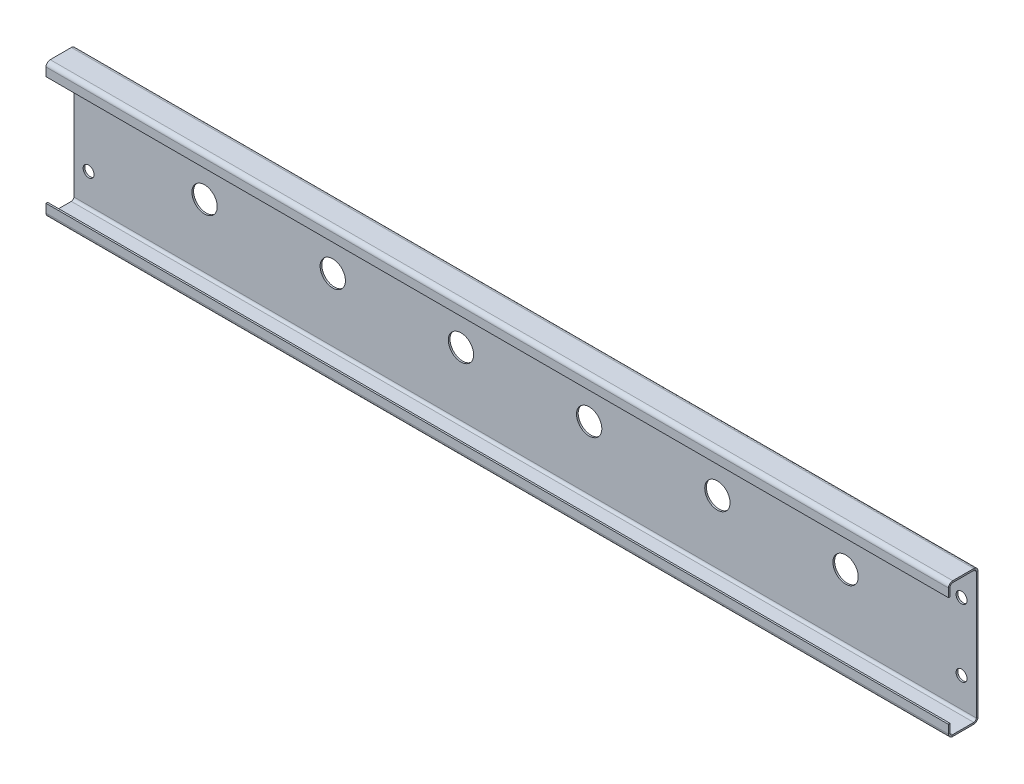
from build123d import *

# Parameters (mm, degrees)
SKETCH1_W                      = 1070
SKETCH1_H                      = 160
BASE_FLANGE1_DEPTH             = 2
EDGE_FLANGE1_STRIP_W           = 14
EDGE_FLANGE1_STRIP_H           = 2
EDGE_FLANGE1_STRIP_CUT_DEPTH   = 1070
EDGE_FLANGE1_STRIP_2_W         = 14
EDGE_FLANGE1_STRIP_2_H         = 2
EDGE_FLANGE1_STRIP_CUT_2_DEPTH = 1070
EDGE_FLANGE1_DEPTH             = 1070
EDGE_FLANGE1_BEND_DEPTH        = 1070
EDGE_FLANGE2_STRIP_W           = 14
EDGE_FLANGE2_STRIP_H           = 2
EDGE_FLANGE2_STRIP_CUT_DEPTH   = 1070
EDGE_FLANGE2_STRIP_2_W         = 14
EDGE_FLANGE2_STRIP_2_H         = 2
EDGE_FLANGE2_STRIP_CUT_2_DEPTH = 1070
EDGE_FLANGE2_DEPTH             = 1070
EDGE_FLANGE2_BEND_DEPTH        = 1070
SKETCH18_R                     = 6.5
CUT_EXTRUDE1_DEPTH             = 10
SKETCH19_R                     = 15
CUT_EXTRUDE2_DEPTH             = 542.953872576
LPATTERN1_COUNT                = 6
LPATTERN1_PITCH                = 152


# Sheet-metal steps are written as plain solids
with BuildPart() as part:
    # Sketch1 → Base-Flange1 (new body)
    with BuildSketch(Plane.XY):
        Rectangle(SKETCH1_W, SKETCH1_H)
    extrude(amount=-BASE_FLANGE1_DEPTH)

    # Edge-Flange1 strip (across the edge) → Edge-Flange1 strip cut (cut)
    with BuildSketch(Plane(origin=(535, 80, 0), x_dir=(0, -1, 0), z_dir=(-1, 0, 0))):
        with Locations((-2, -1)):
            Rectangle(EDGE_FLANGE1_STRIP_W, EDGE_FLANGE1_STRIP_H)
    extrude(amount=EDGE_FLANGE1_STRIP_CUT_DEPTH, mode=Mode.SUBTRACT)

    # Edge-Flange1 strip 2 (across the edge) → Edge-Flange1 strip cut 2 (cut)
    with BuildSketch(Plane(origin=(-535, -80, 0), x_dir=(0, 1, 0), z_dir=(1, 0, 0))):
        with Locations((-2, -1)):
            Rectangle(EDGE_FLANGE1_STRIP_2_W, EDGE_FLANGE1_STRIP_2_H)
    extrude(amount=EDGE_FLANGE1_STRIP_CUT_2_DEPTH, mode=Mode.SUBTRACT)

    # Edge-Flange1 section (across the edge) → Edge-Flange1 (add)
    with BuildSketch(Plane(origin=(535, 80, 0), x_dir=(0, -1, 0), z_dir=(-1, 0, 0))):
        with BuildLine():
            Line((0, 3), (0, 33))
            Line((0, 33), (2, 33))
            Line((2, 33), (2, 3))
            ThreePointArc((2, 3), (2.878679656, 0.878679656), (5, 0))
            Line((5, 0), (5, -2))
            ThreePointArc((5, -2), (1.464466094, -0.535533906), (0, 3))
        make_face()
    extrude(amount=EDGE_FLANGE1_DEPTH)

    # Edge-Flange1 section 2 (across the edge) → Edge-Flange1 bend (add)
    with BuildSketch(Plane(origin=(-535, -80, 0), x_dir=(0, 1, 0), z_dir=(1, 0, 0))):
        with BuildLine():
            Line((0, 3), (0, 33))
            Line((0, 33), (2, 33))
            Line((2, 33), (2, 3))
            ThreePointArc((2, 3), (2.878679656, 0.878679656), (5, 0))
            Line((5, 0), (5, -2))
            ThreePointArc((5, -2), (1.464466094, -0.535533906), (0, 3))
        make_face()
    extrude(amount=EDGE_FLANGE1_BEND_DEPTH)

    # Edge-Flange2 strip (across the edge) → Edge-Flange2 strip cut (cut)
    with BuildSketch(Plane(origin=(-535, -78, 33), x_dir=(0, 0, -1), z_dir=(1, 0, 0))):
        with Locations((-2, -1)):
            Rectangle(EDGE_FLANGE2_STRIP_W, EDGE_FLANGE2_STRIP_H)
    extrude(amount=EDGE_FLANGE2_STRIP_CUT_DEPTH, mode=Mode.SUBTRACT)

    # Edge-Flange2 strip 2 (across the edge) → Edge-Flange2 strip cut 2 (cut)
    with BuildSketch(Plane(origin=(535, 78, 33), x_dir=(0, 0, -1), z_dir=(-1, 0, 0))):
        with Locations((-2, -1)):
            Rectangle(EDGE_FLANGE2_STRIP_2_W, EDGE_FLANGE2_STRIP_2_H)
    extrude(amount=EDGE_FLANGE2_STRIP_CUT_2_DEPTH, mode=Mode.SUBTRACT)

    # Edge-Flange2 section (across the edge) → Edge-Flange2 (add)
    with BuildSketch(Plane(origin=(-535, -78, 33), x_dir=(0, 0, -1), z_dir=(1, 0, 0))):
        with BuildLine():
            Line((0, 3), (0, 13))
            Line((0, 13), (2, 13))
            Line((2, 13), (2, 3))
            ThreePointArc((2, 3), (2.878679656, 0.878679656), (5, 0))
            Line((5, 0), (5, -2))
            ThreePointArc((5, -2), (1.464466094, -0.535533906), (0, 3))
        make_face()
    extrude(amount=EDGE_FLANGE2_DEPTH)

    # Edge-Flange2 section 2 (across the edge) → Edge-Flange2 bend (add)
    with BuildSketch(Plane(origin=(535, 78, 33), x_dir=(0, 0, -1), z_dir=(-1, 0, 0))):
        with BuildLine():
            Line((0, 3), (0, 13))
            Line((0, 13), (2, 13))
            Line((2, 13), (2, 3))
            ThreePointArc((2, 3), (2.878679656, 0.878679656), (5, 0))
            Line((5, 0), (5, -2))
            ThreePointArc((5, -2), (1.464466094, -0.535533906), (0, 3))
        make_face()
    extrude(amount=EDGE_FLANGE2_BEND_DEPTH)

    # Sketch18 → Cut-Extrude1 (cut)
    with BuildSketch(Plane.XY):
        with Locations((-517.5, 40)):
            Circle(SKETCH18_R)
        with Locations((-517.5, -40)):
            Circle(SKETCH18_R)
        with Locations((517.5, -40)):
            Circle(SKETCH18_R)
        with Locations((517.5, 40)):
            Circle(SKETCH18_R)
    extrude(amount=-CUT_EXTRUDE1_DEPTH, mode=Mode.SUBTRACT)

    # Sketch19 → Cut-Extrude2 (cut, symmetric)
    with BuildSketch(Plane.XY):
        with Locations((380, 0)):
            Circle(SKETCH19_R)
    cut_extrude2 = extrude(amount=CUT_EXTRUDE2_DEPTH, both=True, mode=Mode.SUBTRACT)

    # LPattern1: Cut-Extrude2 ×6
    with Locations(*[(-i * LPATTERN1_PITCH, 0, 0) for i in range(1, LPATTERN1_COUNT)]):
        add(cut_extrude2, mode=Mode.SUBTRACT)


solid = part.part
